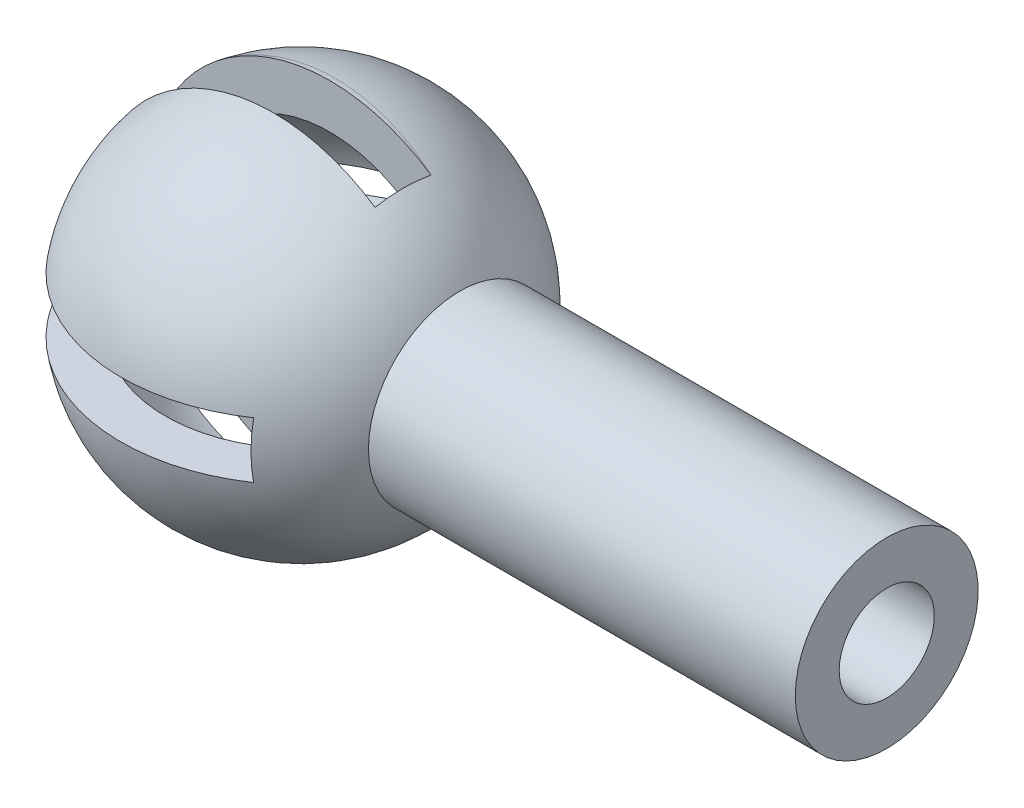
from build123d import *

# Parameters (mm, degrees)
SKETCH2_W          = 22.6684766
SKETCH2_H          = 3.83129182
CUT_EXTRUDE1_DEPTH = 44.732139211
CIRPATTERN1_COUNT  = 4


with BuildPart() as part:
    # Sketch1 → Revolve1 (revolve)
    with BuildSketch(Plane.XY):
        with BuildLine():
            Line((40, 6.25), (10.825317547, 6.25))
            ThreePointArc((10.825317547, 6.25), (-2.255749409, 12.29477916), (-12.338962679, 2))
            Line((-12.338962679, 2), (-9.287087811, 2))
            ThreePointArc((-9.287087811, 2), (1.005650486, 9.446621994), (9.5, 0))
            Line((9.5, 0), (15, 0))
            Line((15, 0), (15, 3.25))
            Line((15, 3.25), (40, 3.25))
            Line((40, 3.25), (40, 6.25))
        make_face()
    revolve(axis=Axis((9.5, 0, 0), (1, 0, 0)))

    # Sketch2 → Cut-Extrude1 (cut, through all)
    with BuildSketch(Plane.XY):
        with Locations((-4.394723676, 0)):
            Rectangle(SKETCH2_W, SKETCH2_H)
    cut_extrude1 = extrude(amount=CUT_EXTRUDE1_DEPTH, mode=Mode.SUBTRACT)

    # CirPattern1: Cut-Extrude1 ×4 about axis
    cirpattern1_axis = Axis((9.5, 0, 0), (-1, 0, 0))
    for i in range(1, CIRPATTERN1_COUNT):
        add(cut_extrude1.rotate(cirpattern1_axis, i * 360 / CIRPATTERN1_COUNT), mode=Mode.SUBTRACT)


solid = part.part
